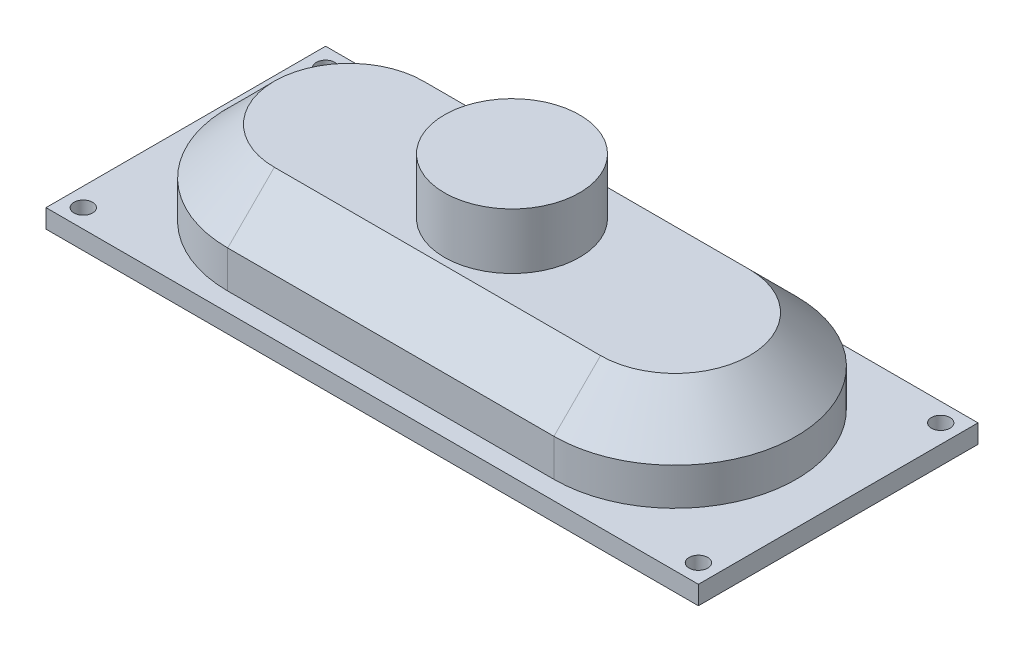
from build123d import *

# Parameters (mm, degrees)
SKETCH_1_W          = 70
SKETCH_1_H          = 30
EXTRUDE_1_DEPTH     = 2
SKETCH_2_R          = 1
CUT_EXTRUDE_1_DEPTH = 39.13135193
EXTRUDE_2_DEPTH     = 9
CHAMFER_2_SIZE      = 5
SHELL_2_DEPTH       = 5.585786438
SHELL_2_2_DEPTH     = 1
SKETCH_4_R          = 7.25
EXTRUDE_3_DEPTH     = 6


with BuildPart() as part:
    # 草图1 → 凸台-拉伸1 (new body)
    with BuildSketch(Plane(origin=(0, 0, 0), x_dir=(1, 0, 0), z_dir=(0, 1, 0))):
        Rectangle(SKETCH_1_W, SKETCH_1_H)
    extrude(amount=EXTRUDE_1_DEPTH)

    # 草图2 → 切除-拉伸1 (cut, through all)
    with BuildSketch(Plane(origin=(0, 2, 0), x_dir=(1, 0, 0), z_dir=(0, 1, 0))):
        with Locations(Location((-33, 13, 0), (0, 0, 270))):
            Circle(SKETCH_2_R)
        with Locations(Location((33, 13, 0), (0, 0, 90))):
            Circle(SKETCH_2_R)
        with Locations(Location((33, -13, 0), (0, 0, 270))):
            Circle(SKETCH_2_R)
        with Locations(Location((-33, -13, 0), (0, 0, 90))):
            Circle(SKETCH_2_R)
    extrude(amount=-CUT_EXTRUDE_1_DEPTH, mode=Mode.SUBTRACT)

    # 草图3 → 凸台-拉伸2 (add)
    with BuildSketch(Plane(origin=(0, 2, 0), x_dir=(1, 0, 0), z_dir=(0, 1, 0))):
        with BuildLine():
            Line((-17.5, 13), (17.5, 13))
            ThreePointArc((17.5, 13), (30.5, 0), (17.5, -13))
            Line((17.5, -13), (-17.5, -13))
            ThreePointArc((-17.5, -13), (-30.5, 0), (-17.5, 13))
        make_face()
    extrude(amount=EXTRUDE_2_DEPTH)

    # 倒角2
    chamfer_2_edges = [part.edges().sort_by_distance(p)[0] for p in [
        (-30.5, 11, 0),
        (0, 11, 13),
        (30.5, 11, 0),
        (0, 11, -13),
    ]]
    chamfer(chamfer_2_edges, length=CHAMFER_2_SIZE)

    # 抽壳2: read off the stored shape, not the designer's step
    # 抽壳2 outline → 抽壳2 (cut)
    with BuildSketch(Plane(origin=(0, 0, 0), x_dir=(1, 0, 0), z_dir=(0, 1, 0))):
        with BuildLine():
            ThreePointArc((-17.5, 12), (-29.5, 0), (-17.5, -12))
            Line((-17.5, -12), (17.5, -12))
            ThreePointArc((17.5, -12), (29.5, 0), (17.5, 12))
            Line((17.5, 12), (-17.5, 12))
        make_face()
    extrude(amount=SHELL_2_DEPTH, mode=Mode.SUBTRACT)

    # Shell 2 2 outline → Shell 2 2 (cut)
    with BuildSketch(Plane(origin=(0, 0, 0), x_dir=(1, 0, 0), z_dir=(0, 1, 0))):
        with BuildLine():
            Line((-34, 11.267949192), (-34, -11.267949192))
            ThreePointArc((-34, -11.267949192), (-31.585786438, -11.585786438), (-31.267949192, -14))
            Line((-31.267949192, -14), (31.267949192, -14))
            ThreePointArc((31.267949192, -14), (31.585786438, -11.585786438), (34, -11.267949192))
            Line((34, -11.267949192), (34, 11.267949192))
            ThreePointArc((34, 11.267949192), (31.585786438, 11.585786438), (31.267949192, 14))
            Line((31.267949192, 14), (-31.267949192, 14))
            ThreePointArc((-31.267949192, 14), (-31.585786438, 11.585786438), (-34, 11.267949192))
        make_face()
        with BuildLine():
            Line((17.5, -12), (-17.5, -12))
            ThreePointArc((-17.5, -12), (-29.5, 0), (-17.5, 12))
            Line((-17.5, 12), (17.5, 12))
            ThreePointArc((17.5, 12), (29.5, 0), (17.5, -12))
        make_face(mode=Mode.SUBTRACT)
    extrude(amount=SHELL_2_2_DEPTH, mode=Mode.SUBTRACT)

    # Shell 2 3: loft between two sections, ruled curve by curve
    shell_2_3_from = [
        Edge.make_three_point_arc((17.5, 10, -7.585786438), (22.863961031, 10, -5.363961031), (25.085786438, 10, 0)),
        Edge.make_three_point_arc((25.085786438, 10, 0), (22.863961031, 10, 5.363961031), (17.5, 10, 7.585786438)),
        Edge.make_three_point_arc((-17.5, 10, 7.585786438), (-22.863961031, 10, 5.363961031), (-25.085786438, 10, 0)),
        Edge.make_three_point_arc((-25.085786438, 10, 0), (-22.863961031, 10, -5.363961031), (-17.5, 10, -7.585786438)),
        Edge.make_line((17.5, 10, -7.585786438), (-17.5, 10, -7.585786438)),
        Edge.make_line((17.5, 10, 7.585786438), (-17.5, 10, 7.585786438)),
    ]
    shell_2_3_to = [
        Edge.make_three_point_arc((17.5, 5.585786438, -12), (25.985281374, 5.585786438, -8.485281374), (29.5, 5.585786438, 0)),
        Edge.make_three_point_arc((29.5, 5.585786438, 0), (25.985281374, 5.585786438, 8.485281374), (17.5, 5.585786438, 12)),
        Edge.make_three_point_arc((-17.5, 5.585786438, 12), (-25.985281374, 5.585786438, 8.485281374), (-29.5, 5.585786438, 0)),
        Edge.make_three_point_arc((-29.5, 5.585786438, 0), (-25.985281374, 5.585786438, -8.485281374), (-17.5, 5.585786438, -12)),
        Edge.make_line((17.5, 5.585786438, -12), (-17.5, 5.585786438, -12)),
        Edge.make_line((17.5, 5.585786438, 12), (-17.5, 5.585786438, 12)),
    ]
    shell_2_3 = Solid(Shell([*[Face.make_surface_from_curves(shell_2_3_from[k], shell_2_3_to[k]) for k in range(6)], Face(Wire(shell_2_3_from)), Face(Wire(shell_2_3_to))]))
    add(shell_2_3, mode=Mode.SUBTRACT)

    # 草图4 → 凸台-拉伸3 (add)
    with BuildSketch(Plane(origin=(0, 11, 0), x_dir=(1, 0, 0), z_dir=(0, 1, 0))):
        with Locations(Location((0, 0, 0), (0, 0, 270))):
            Circle(SKETCH_4_R)
    extrude(amount=EXTRUDE_3_DEPTH)


solid = part.part
